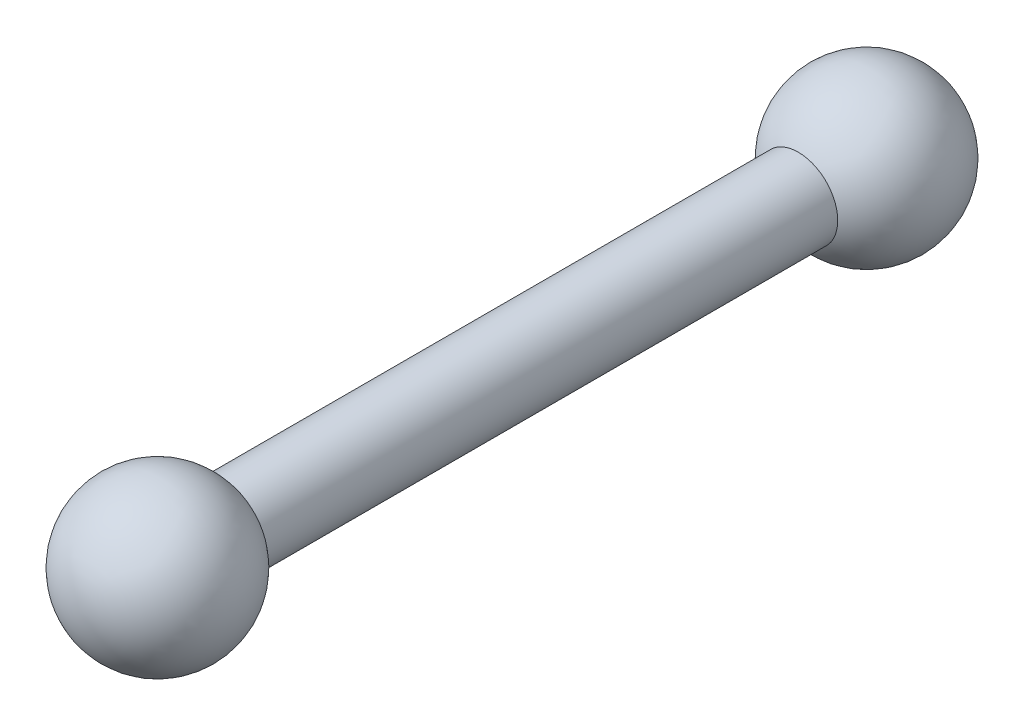
from build123d import *

# Parameters (mm, degrees)
SKETCH1_R           = 2
BOSS_EXTRUDE1_DEPTH = 30


with BuildPart() as part:
    # Sketch1 → Boss-Extrude1 (new body)
    with BuildSketch(Plane.XY):
        Circle(SKETCH1_R)
    extrude(amount=-BOSS_EXTRUDE1_DEPTH)

    # Sketch2 → Revolve1 (revolve)
    with BuildSketch(Plane.XY.offset(3)):
        with BuildLine():
            Line((0, 4), (0, -4))
            ThreePointArc((0, -4), (4, 0), (0, 4))
        make_face()
    revolve1 = revolve(axis=Axis((0, 4, 3), (0, -1, 0)))

    # Mirror2: Revolve1 across plane
    add(revolve1.mirror(Plane.XY.offset(-15)))


solid = part.part
